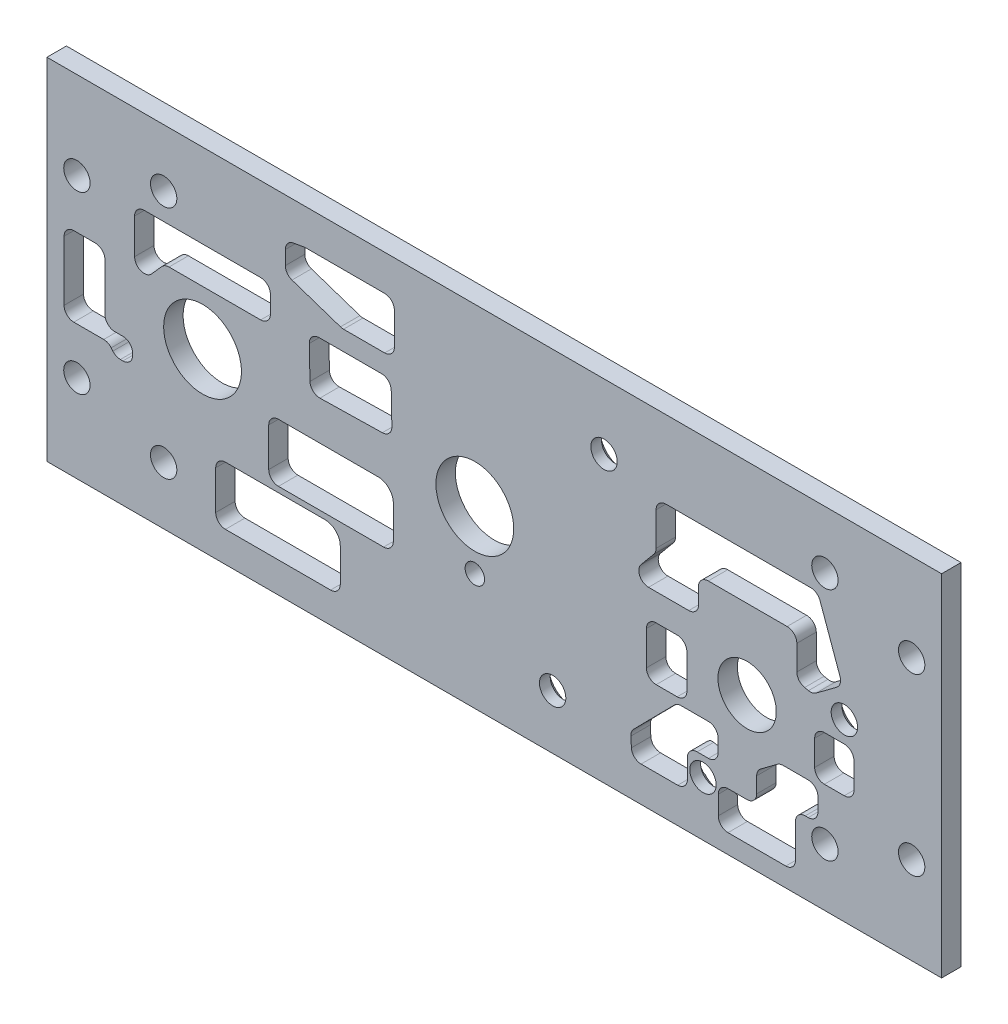
from build123d import *

# Parameters (mm, degrees)
SKETCH1_W                                 = 146.05
SKETCH1_H                                 = 57.15
BOSS_EXTRUDE1_DEPTH                       = 3.175
F_6_CLEARANCE_HOLE1_D                     = 4.3053
F_1_2_0_5_DIAMETER_HOLE1_D                = 12.7
F_3_8_0_375_DIAMETER_HOLE1_D              = 9.525
F_1_8_0_125_DIAMETER_HOLE1_D              = 3.175
CSK_FOR_6_FLAT_HEAD_MACHINE_SCREW_2_COUNT = 2
CSK_FOR_6_FLAT_HEAD_MACHINE_SCREW_2_PITCH = 38.528341037
CSK_FOR_6_FLAT_HEAD_MACHINE_SCREW_3_COUNT = 2
CSK_FOR_6_FLAT_HEAD_MACHINE_SCREW_3_PITCH = 51.534810808
CSK_FOR_6_FLAT_HEAD_MACHINE_SCREW_4_COUNT = 2
CSK_FOR_6_FLAT_HEAD_MACHINE_SCREW_4_PITCH = 24.55
CUT_EXTRUDE1_DEPTH                        = 157.865565453


with BuildPart() as part:
    # Sketch1 → Boss-Extrude1 (new body)
    with BuildSketch(Plane.XY):
        with Locations((-73.025, 28.575)):
            Rectangle(SKETCH1_W, SKETCH1_H)
    extrude(amount=-BOSS_EXTRUDE1_DEPTH)

    # #6 Clearance Hole1 (through all)
    with Locations(Plane(origin=(0, 0, -3.175), x_dir=(-1, 0, 0), z_dir=(0, 0, -1))):
        with Locations((4.8895, 42.8625), (141.1605, 42.8625), (141.1605, 14.2875), (4.8895, 14.2875), (19.05, 47.752), (19.05, 9.398), (127, 9.398), (127, 47.752)):
            Hole(F_6_CLEARANCE_HOLE1_D / 2)

    # 1/2 (0.5) Diameter Hole1 (through all)
    with Locations(Plane(origin=(0, 0, -3.175), x_dir=(-1, 0, 0), z_dir=(0, 0, -1))):
        with Locations((76.2, 28.575), (120.65, 28.575)):
            Hole(F_1_2_0_5_DIAMETER_HOLE1_D / 2)

    # 3/8 (0.375) Diameter Hole1 (through all)
    with Locations(Plane(origin=(0, 0, -3.175), x_dir=(-1, 0, 0), z_dir=(0, 0, -1))):
        with Locations((31.75, 24.13)):
            Hole(F_3_8_0_375_DIAMETER_HOLE1_D / 2)

    # 1/8 (0.125) Diameter Hole1 (through all)
    with Locations(Plane(origin=(0, 0, -3.175), x_dir=(-1, 0, 0), z_dir=(0, 0, -1))):
        with Locations((76.2, 19.05)):
            Hole(F_1_8_0_125_DIAMETER_HOLE1_D / 2)

    # Sketch14 → CSK for #6 Flat Head Machine Screw (100)2 (revolve, cut)
    with BuildSketch(Plane(origin=(-63.5, 8.89, -3.175), x_dir=(0, 1, 0), z_dir=(1, 0, 0))):
        Polygon((0, 0), (0, 3.175), (2.15265, 3.175), (2.15265, 1.420893136), (3.8460045, 0), align=None)
    csk_for_6_flat_head_machine_screw_100 = revolve(axis=Axis((-63.5, 8.89, -9.525), (0, 0, 1)), mode=Mode.SUBTRACT)

    # CSK for _6 Flat Head Machine Screw _ 2: CSK for #6 Flat Head Machine Screw (100)2 ×2
    with Locations(*[Vector(0.21781400598375378, 0.9759902964667782, 0) * (i * CSK_FOR_6_FLAT_HEAD_MACHINE_SCREW_2_PITCH) for i in range(1, CSK_FOR_6_FLAT_HEAD_MACHINE_SCREW_2_COUNT)]):
        add(csk_for_6_flat_head_machine_screw_100, mode=Mode.SUBTRACT)

    # CSK for _6 Flat Head Machine Screw _ 3: CSK for #6 Flat Head Machine Screw (100)2 ×2
    with Locations(*[Vector(0.924132625179902, 0.38207184020561197, 0) * (i * CSK_FOR_6_FLAT_HEAD_MACHINE_SCREW_3_PITCH) for i in range(1, CSK_FOR_6_FLAT_HEAD_MACHINE_SCREW_3_COUNT)]):
        add(csk_for_6_flat_head_machine_screw_100, mode=Mode.SUBTRACT)

    # CSK for _6 Flat Head Machine Screw _ 4: CSK for #6 Flat Head Machine Screw (100)2 ×2
    with Locations(*[(i * CSK_FOR_6_FLAT_HEAD_MACHINE_SCREW_4_PITCH, 0, 0) for i in range(1, CSK_FOR_6_FLAT_HEAD_MACHINE_SCREW_4_COUNT)]):
        add(csk_for_6_flat_head_machine_screw_100, mode=Mode.SUBTRACT)

    # Sketch15 → Cut-Extrude1 (cut, through all)
    with BuildSketch(Plane(origin=(0, 0, -3.175), x_dir=(-1, 0, 0), z_dir=(0, 0, -1))):
        with BuildLine():
            Line((21.347193944, 44.496737247), (45.012101975, 44.496737247))
            ThreePointArc((45.012101975, 44.496737247), (46.13463399, 44.031769262), (46.599601975, 42.909237247))
            Line((46.599601975, 42.909237247), (46.599601975, 37.455762014))
            ThreePointArc((46.599601975, 37.455762014), (46.694341195, 36.915556958), (46.967251112, 36.439828885))
            Line((46.967251112, 36.439828885), (49.067386427, 33.918155163))
            ThreePointArc((49.067386427, 33.918155163), (49.285059493, 32.228663422), (47.847535564, 31.314722034))
            Line((47.847535564, 31.314722034), (41.272484934, 31.314722034))
            ThreePointArc((41.272484934, 31.314722034), (40.149952919, 31.779690019), (39.684984934, 32.902222034))
            Line((39.684984934, 32.902222034), (39.684984934, 35.500151839))
            ThreePointArc((39.684984934, 35.500151839), (39.220016949, 36.622683854), (38.097484934, 37.087651839))
            Line((38.097484934, 37.087651839), (25.219946674, 37.087651839))
            ThreePointArc((25.219946674, 37.087651839), (24.097414659, 36.622683854), (23.632446674, 35.500151839))
            Line((23.632446674, 35.500151839), (23.632446674, 31.446490195))
            ThreePointArc((23.632446674, 31.446490195), (23.273220148, 30.440756372), (22.358115307, 29.89018635))
            Line((22.358115307, 29.89018635), (21.735086079, 29.764816737))
            ThreePointArc((21.735086079, 29.764816737), (21.07300381, 29.772438715), (20.4716192, 30.049472244))
            Line((20.4716192, 30.049472244), (17.132713919, 32.544624196))
            ThreePointArc((17.132713919, 32.544624196), (16.562797005, 33.358995683), (16.588867746, 34.352638739))
            Line((16.588867746, 34.352638739), (19.853049526, 43.445603453))
            ThreePointArc((19.853049526, 43.445603453), (20.433773204, 44.207628098), (21.347193944, 44.496737247))
        make_face()
        with BuildLine():
            Line((43.169356355, 26.904141136), (46.599601975, 26.904141136))
            ThreePointArc((46.599601975, 26.904141136), (47.72213399, 26.439173151), (48.187101975, 25.316641136))
            Line((48.187101975, 25.316641136), (48.187101975, 19.759113808))
            ThreePointArc((48.187101975, 19.759113808), (47.72213399, 18.636581793), (46.599601975, 18.171613808))
            Line((46.599601975, 18.171613808), (43.169356355, 18.171613808))
            ThreePointArc((43.169356355, 18.171613808), (42.04682434, 18.636581793), (41.581856355, 19.759113808))
            Line((41.581856355, 19.759113808), (41.581856355, 25.316641136))
            ThreePointArc((41.581856355, 25.316641136), (42.04682434, 26.439173151), (43.169356355, 26.904141136))
        make_face()
        with BuildLine():
            Line((90.921011843, 42.909237247), (97.627094123, 42.909237247))
            ThreePointArc((97.627094123, 42.909237247), (97.883044016, 42.930006287), (98.132296795, 42.991769968))
            Line((98.132296795, 42.991769968), (106.05071482, 45.6499048))
            ThreePointArc((106.05071482, 45.6499048), (106.83434214, 46.228009897), (107.133012148, 47.154872079))
            Line((107.133012148, 47.154872079), (107.133012148, 49.428843388))
            ThreePointArc((107.133012148, 49.428843388), (106.764882465, 50.44535324), (105.831226598, 50.990420636))
            Line((105.831226598, 50.990420636), (104.128792397, 51.30190702))
            ThreePointArc((104.128792397, 51.30190702), (103.986521957, 51.321335801), (103.843077948, 51.327829771))
            Line((103.843077948, 51.327829771), (90.921011843, 51.327829771))
            ThreePointArc((90.921011843, 51.327829771), (89.798479828, 50.862861786), (89.333511843, 49.740329771))
            Line((89.333511843, 49.740329771), (89.333511843, 44.496737247))
            ThreePointArc((89.333511843, 44.496737247), (89.798479828, 43.374205232), (90.921011843, 42.909237247))
        make_face()
        with BuildLine():
            Line((103.220242116, 38.105312947), (103.112575597, 32.790055366))
            ThreePointArc((103.112575597, 32.790055366), (102.624969488, 31.677170091), (101.493251178, 31.235030952))
            Line((101.493251178, 31.235030952), (91.297625996, 31.441554804))
            ThreePointArc((91.297625996, 31.441554804), (90.184740721, 31.929160912), (89.742601583, 33.060879223))
            Line((89.742601583, 33.060879223), (89.846084729, 38.169612952))
            ThreePointArc((89.846084729, 38.169612952), (90.322152012, 39.271304733), (91.433259145, 39.72496295))
            Line((91.433259145, 39.72496295), (101.633067699, 39.72496295))
            ThreePointArc((101.633067699, 39.72496295), (102.766909483, 39.248570083), (103.220242116, 38.105312947))
        make_face()
        with BuildLine():
            Line((111.160618469, 37.455762014), (126.127535918, 37.455762014))
            ThreePointArc((126.127535918, 37.455762014), (126.77887845, 37.315987526), (127.315523571, 36.921277487))
            Line((127.315523571, 36.921277487), (128.96801187, 35.056978482))
            ThreePointArc((128.96801187, 35.056978482), (130.719127329, 34.625728707), (131.743499523, 36.109993954))
            Line((131.743499523, 36.109993954), (131.743499523, 41.858103453))
            ThreePointArc((131.743499523, 41.858103453), (131.278531539, 42.980635468), (130.155999523, 43.445603453))
            Line((130.155999523, 43.445603453), (111.160618469, 43.445603453))
            ThreePointArc((111.160618469, 43.445603453), (110.038086454, 42.980635468), (109.573118469, 41.858103453))
            Line((109.573118469, 41.858103453), (109.573118469, 39.043262014))
            ThreePointArc((109.573118469, 39.043262014), (110.038086454, 37.920729999), (111.160618469, 37.455762014))
        make_face()
        with BuildLine():
            Line((143.255373049, 33.242227878), (143.255373049, 23.47393246))
            ThreePointArc((143.255373049, 23.47393246), (142.790405064, 22.351400445), (141.667873049, 21.88643246))
            Line((141.667873049, 21.88643246), (136.779061524, 21.88643246))
            ThreePointArc((136.779061524, 21.88643246), (136.105159667, 21.73629551), (135.558725615, 21.314282902))
            Line((135.558725615, 21.314282902), (135.284677058, 20.984907662))
            ThreePointArc((135.284677058, 20.984907662), (134.738243005, 20.562895054), (134.064341149, 20.412758104))
            Line((134.064341149, 20.412758104), (133.647888744, 20.412758104))
            ThreePointArc((133.647888744, 20.412758104), (132.525356729, 20.877726089), (132.060388744, 22.000258104))
            Line((132.060388744, 22.000258104), (132.060388744, 22.31048244))
            ThreePointArc((132.060388744, 22.31048244), (132.525356729, 23.433014455), (133.647888744, 23.89798244))
            Line((133.647888744, 23.89798244), (134.989635559, 23.89798244))
            ThreePointArc((134.989635559, 23.89798244), (136.112167574, 24.362950425), (136.577135559, 25.48548244))
            Line((136.577135559, 25.48548244), (136.577135559, 33.242227878))
            ThreePointArc((136.577135559, 33.242227878), (137.042103544, 34.364759893), (138.164635559, 34.829727878))
            Line((138.164635559, 34.829727878), (141.667873049, 34.829727878))
            ThreePointArc((141.667873049, 34.829727878), (142.790405064, 34.364759893), (143.255373049, 33.242227878))
        make_face()
        with BuildLine():
            Line((91.971428074, 24.859821073), (108.256192097, 24.859821073))
            ThreePointArc((108.256192097, 24.859821073), (109.378724112, 24.394853088), (109.843692097, 23.272321073))
            Line((109.843692097, 23.272321073), (109.843692097, 16.967692025))
            ThreePointArc((109.843692097, 16.967692025), (109.378724112, 15.84516001), (108.256192097, 15.380192025))
            Line((108.256192097, 15.380192025), (91.093123739, 15.380192025))
            ThreePointArc((91.093123739, 15.380192025), (89.970591724, 15.84516001), (89.505623739, 16.967692025))
            Line((89.505623739, 16.967692025), (89.505623739, 22.394016738))
            ThreePointArc((89.505623739, 22.394016738), (90.227841108, 24.137603704), (91.971428074, 24.859821073))
        make_face()
        with BuildLine():
            Line((15.893552079, 25.131070029), (19.13395461, 25.131070029))
            ThreePointArc((19.13395461, 25.131070029), (20.256486625, 24.666102045), (20.72145461, 23.543570029))
            Line((20.72145461, 23.543570029), (20.72145461, 19.410181066))
            ThreePointArc((20.72145461, 19.410181066), (20.256486625, 18.287649051), (19.13395461, 17.822681066))
            Line((19.13395461, 17.822681066), (15.893552079, 17.822681066))
            ThreePointArc((15.893552079, 17.822681066), (14.771020064, 18.287649051), (14.306052079, 19.410181066))
            Line((14.306052079, 19.410181066), (14.306052079, 23.543570029))
            ThreePointArc((14.306052079, 23.543570029), (14.771020064, 24.666102045), (15.893552079, 25.131070029))
        make_face()
        with BuildLine():
            Line((20.187933278, 15.530456539), (20.187933278, 13.381249162))
            ThreePointArc((20.187933278, 13.381249162), (20.652901263, 12.258717147), (21.775433278, 11.793749162))
            Line((21.775433278, 11.793749162), (22.263834273, 11.793749162))
            ThreePointArc((22.263834273, 11.793749162), (23.386366288, 11.328781177), (23.851334273, 10.206249162))
            Line((23.851334273, 10.206249162), (23.851334273, 4.700283324))
            ThreePointArc((23.851334273, 4.700283324), (24.316302258, 3.577751308), (25.438834273, 3.112783324))
            Line((25.438834273, 3.112783324), (34.874268774, 3.112783324))
            ThreePointArc((34.874268774, 3.112783324), (35.996800789, 3.577751308), (36.461768774, 4.700283324))
            Line((36.461768774, 4.700283324), (36.461768774, 7.752404274))
            ThreePointArc((36.461768774, 7.752404274), (35.996800789, 8.874936289), (34.874268774, 9.339904274))
            Line((34.874268774, 9.339904274), (31.78095374, 9.339904274))
            ThreePointArc((31.78095374, 9.339904274), (30.658421725, 9.804872259), (30.19345374, 10.927404274))
            Line((30.19345374, 10.927404274), (30.19345374, 13.48766735))
            ThreePointArc((30.19345374, 13.48766735), (30.02535773, 14.198616408), (29.556668149, 14.759004584))
            Line((29.556668149, 14.759004584), (26.824960358, 16.801793773))
            ThreePointArc((26.824960358, 16.801793773), (26.375199236, 17.036843625), (25.87424595, 17.117956539))
            Line((25.87424595, 17.117956539), (21.775433278, 17.117956539))
            ThreePointArc((21.775433278, 17.117956539), (20.652901263, 16.652988554), (20.187933278, 15.530456539))
        make_face()
        with BuildLine():
            Line((36.483523041, 15.650989317), (36.483523041, 13.606717392))
            ThreePointArc((36.483523041, 13.606717392), (36.948491026, 12.484185376), (38.071023041, 12.019217392))
            Line((38.071023041, 12.019217392), (39.909174943, 12.019217392))
            ThreePointArc((39.909174943, 12.019217392), (41.031706958, 11.554249407), (41.496674943, 10.431717392))
            Line((41.496674943, 10.431717392), (41.496674943, 7.305820432))
            ThreePointArc((41.496674943, 7.305820432), (41.961642928, 6.183288417), (43.084174943, 5.718320432))
            Line((43.084174943, 5.718320432), (49.055466067, 5.718320432))
            ThreePointArc((49.055466067, 5.718320432), (50.148470915, 6.154518277), (50.640825232, 7.223403391))
            Line((50.640825232, 7.223403391), (50.725030888, 8.84316804))
            ThreePointArc((50.725030888, 8.84316804), (50.623544664, 9.489745826), (50.269837885, 10.040430674))
            Line((50.269837885, 10.040430674), (43.635603444, 16.76583491))
            ThreePointArc((43.635603444, 16.76583491), (43.117948045, 17.115566667), (42.505437282, 17.238489317))
            Line((42.505437282, 17.238489317), (38.071023041, 17.238489317))
            ThreePointArc((38.071023041, 17.238489317), (36.948491026, 16.773521332), (36.483523041, 15.650989317))
        make_face()
        with BuildLine():
            Line((100.644391219, 14.468733258), (116.913946114, 14.468733258))
            ThreePointArc((116.913946114, 14.468733258), (118.036478129, 14.003765273), (118.501446114, 12.881233258))
            Line((118.501446114, 12.881233258), (118.501446114, 6.561395082))
            ThreePointArc((118.501446114, 6.561395082), (118.036478129, 5.438863067), (116.913946114, 4.973895082))
            Line((116.913946114, 4.973895082), (99.750877756, 4.973895082))
            ThreePointArc((99.750877756, 4.973895082), (98.628345741, 5.438863067), (98.163377756, 6.561395082))
            Line((98.163377756, 6.561395082), (98.163377756, 11.987719795))
            ThreePointArc((98.163377756, 11.987719795), (98.890049775, 13.742061239), (100.644391219, 14.468733258))
        make_face()
    extrude(amount=-CUT_EXTRUDE1_DEPTH, mode=Mode.SUBTRACT)


solid = part.part
